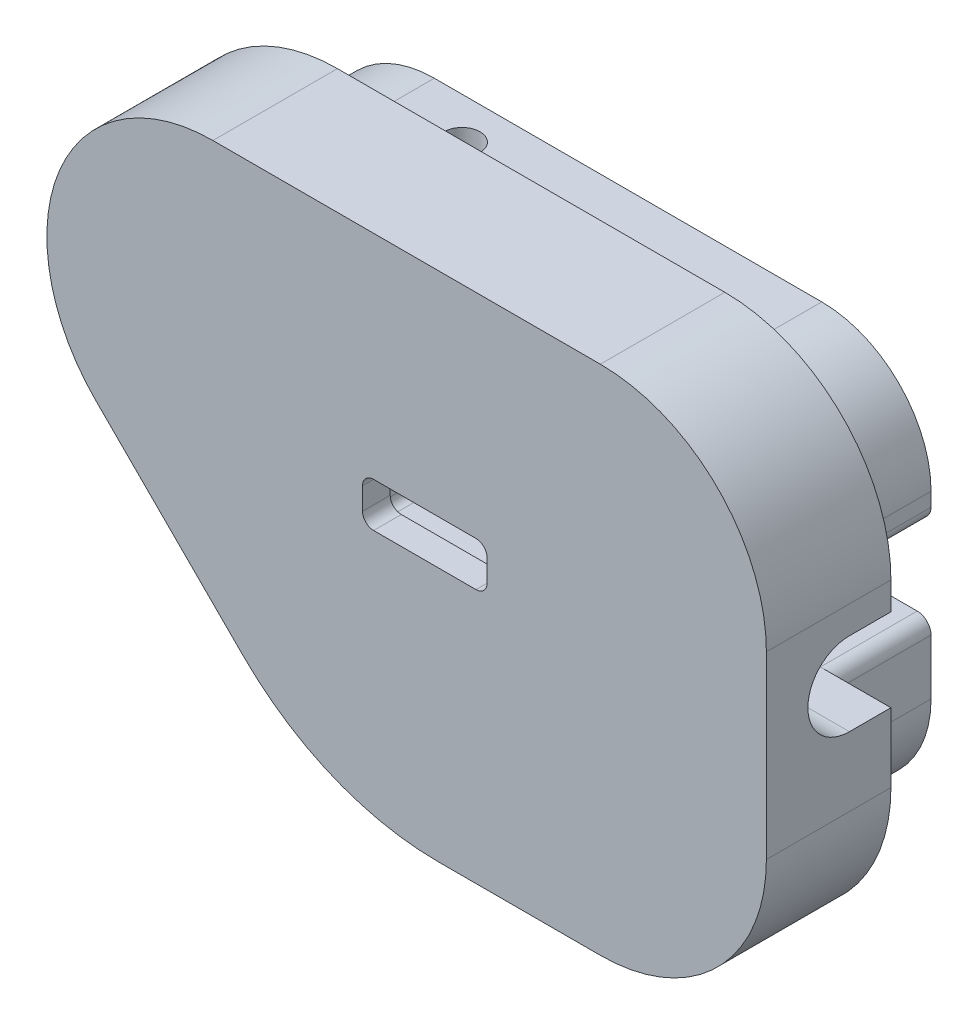
from build123d import *

# Parameters (mm, degrees)
EXTRUDE_1_DEPTH     = 9
EXTRUDE_2_DEPTH     = 7
SKETCH_6_R          = 1.3
CUT_EXTRUDE_1_DEPTH = 6
SKETCH_7_R          = 1.3
CUT_EXTRUDE_2_DEPTH = 6
CUT_EXTRUDE_3_DEPTH = 14
CUT_EXTRUDE_4_DEPTH = 2
EXTRUDE_START       = 9.4
EXTRUDE_4_DEPTH     = 9.4
SKETCH_11_R         = 1.3
CUT_EXTRUDE_5_DEPTH = 6
CHAMFER_1_SIZE      = 0.4
CHAMFER_1_SIZE2     = 1.098990968
CUT_EXTRUDE_6_DEPTH = 13
FILLET_1_R          = 3
FILLET_2_R          = 1


with BuildPart() as part:
    # 草图2 → 凸台-拉伸1 (new body)
    with BuildSketch(Plane.XY):
        with BuildLine():
            Line((-24.798989873, -3.485281374), (-14.142135624, -14.142135624))
            ThreePointArc((-14.142135624, -14.142135624), (-7.653668647, -18.47759065), (0, -20))
            Line((0, -20), (11.686291501, -20))
            ThreePointArc((11.686291501, -20), (20.171572875, -16.485281374), (23.686291501, -8))
            Line((23.686291501, -8), (23.686291501, 5))
            ThreePointArc((23.686291501, 5), (20.171572875, 13.485281374), (11.686291501, 17))
            Line((11.686291501, 17), (-16.313708499, 17))
            ThreePointArc((-16.313708499, 17), (-27.400262889, 9.592201188), (-24.798989873, -3.485281374))
        make_face()
    extrude(amount=-EXTRUDE_1_DEPTH)

    # 草图3 → 凸台-拉伸2 (add)
    with BuildSketch(Plane(origin=(0, 0, -9), x_dir=(-1, 0, 0), z_dir=(0, 0, -1))):
        with BuildLine():
            Line((16.313708499, 12.9), (-11.686291501, 12.9))
            ThreePointArc((-11.686291501, 12.9), (-17.272435072, 10.586143571), (-19.586291501, 5))
            Line((-19.586291501, 5), (-19.586291501, -8))
            ThreePointArc((-19.586291501, -8), (-17.272435072, -13.586143571), (-11.686291501, -15.9))
            Line((-11.686291501, -15.9), (0, -15.9))
            ThreePointArc((0, -15.9), (6.084666575, -14.689684567), (11.242997821, -11.242997821))
            Line((11.242997821, -11.242997821), (21.89985207, -0.586143571))
            ThreePointArc((21.89985207, -0.586143571), (23.612356806, 8.023199116), (16.313708499, 12.9))
        make_face()
    extrude(amount=EXTRUDE_2_DEPTH)

    # 草图6 → 切除-拉伸1 (cut)
    with BuildSketch(Plane(origin=(0, 12.9, 0), x_dir=(1, 0, 0), z_dir=(0, 1, 0))):
        with Locations(Location((-11.313708499, 13, 0), (0, 0, 180))):
            Circle(SKETCH_6_R)
    extrude(amount=-CUT_EXTRUDE_1_DEPTH, mode=Mode.SUBTRACT)

    # 草图7 → 切除-拉伸2 (cut)
    with BuildSketch(Plane.XZ.offset(15.9)):
        with Locations(Location((6.686291501, -13, 0), (0, 0, 270))):
            Circle(SKETCH_7_R)
    extrude(amount=-CUT_EXTRUDE_2_DEPTH, mode=Mode.SUBTRACT)

    # 草图8 → 切除-拉伸3 (cut)
    with BuildSketch(Plane(origin=(0, 0, -16), x_dir=(-1, 0, 0), z_dir=(0, 0, -1))):
        with BuildLine():
            Line((-4, 4), (14, 4))
            ThreePointArc((14, 4), (14.707106781, 3.707106781), (15, 3))
            Line((15, 3), (15, -3))
            ThreePointArc((15, -3), (14.707106781, -3.707106781), (14, -4))
            Line((14, -4), (-4, -4))
            ThreePointArc((-4, -4), (-4.707106781, -3.707106781), (-5, -3))
            Line((-5, -3), (-5, 3))
            ThreePointArc((-5, 3), (-4.707106781, 3.707106781), (-4, 4))
        make_face()
    extrude(amount=-CUT_EXTRUDE_3_DEPTH, mode=Mode.SUBTRACT)

    # 草图9 → 切除-拉伸4 (cut)
    with BuildSketch(Plane(origin=(0, 0, -2), x_dir=(-1, 0, 0), z_dir=(0, 0, -1))):
        with BuildLine():
            Line((-2.7, 1.6), (4.7, 1.6))
            ThreePointArc((4.7, 1.6), (5.265685425, 1.365685425), (5.5, 0.8))
            Line((5.5, 0.8), (5.5, -0.8))
            ThreePointArc((5.5, -0.8), (5.265685425, -1.365685425), (4.7, -1.6))
            Line((4.7, -1.6), (-2.7, -1.6))
            ThreePointArc((-2.7, -1.6), (-3.265685425, -1.365685425), (-3.5, -0.8))
            Line((-3.5, -0.8), (-3.5, 0.8))
            ThreePointArc((-3.5, 0.8), (-3.265685425, 1.365685425), (-2.7, 1.6))
        make_face()
    extrude(amount=-CUT_EXTRUDE_4_DEPTH, mode=Mode.SUBTRACT)

    # 草图10 → 凸台-拉伸4 (add)
    with BuildSketch(Plane(origin=(0, 0, -2), x_dir=(-1, 0, 0), z_dir=(0, 0, -1)).offset(EXTRUDE_START)):
        with BuildLine():
            Line((14, 4), (-4, 4))
            ThreePointArc((-4, 4), (-4.707106781, 3.707106781), (-5, 3))
            Line((-5, 3), (-5, -3))
            ThreePointArc((-5, -3), (-4.707106781, -3.707106781), (-4, -4))
            Line((-4, -4), (14, -4))
            ThreePointArc((14, -4), (14.707106781, -3.707106781), (15, -3))
            Line((15, -3), (15, 3))
            ThreePointArc((15, 3), (14.707106781, 3.707106781), (14, 4))
        make_face()
        with BuildLine():
            Line((-4, -2.6), (6, -2.6))
            ThreePointArc((6, -2.6), (6.424264069, -2.424264069), (6.6, -2))
            Line((6.6, -2), (6.6, 2))
            ThreePointArc((6.6, 2), (6.424264069, 2.424264069), (6, 2.6))
            Line((6, 2.6), (-4, 2.6))
            ThreePointArc((-4, 2.6), (-4.424264069, 2.424264069), (-4.6, 2))
            Line((-4.6, 2), (-4.6, -2))
            ThreePointArc((-4.6, -2), (-4.424264069, -2.424264069), (-4, -2.6))
        make_face(mode=Mode.SUBTRACT)
    extrude(amount=-EXTRUDE_4_DEPTH)

    # 草图11 → 切除-拉伸5 (cut)
    with BuildSketch(Plane(origin=(0, 0, -11.4), x_dir=(-1, 0, 0), z_dir=(0, 0, -1))):
        with Locations((10, 0)):
            Circle(SKETCH_11_R)
    extrude(amount=-CUT_EXTRUDE_5_DEPTH, mode=Mode.SUBTRACT)

    # 倒角1
    chamfer_1_edges = [part.edges().sort_by_distance(p)[0] for p in [
        (-8.7, 0, -11.4),
    ]]
    chamfer_1_side = [part.faces().sort_by_distance(p)[0] for p in [
        (-7.139463972, 0, -11.4),
    ]]
    chamfer(chamfer_1_edges, length=CHAMFER_1_SIZE, length2=CHAMFER_1_SIZE2, reference=chamfer_1_side[0])

    # 草图14 → 切除-拉伸6 (cut)
    with BuildSketch(Plane(origin=(0, 0, -16), x_dir=(-1, 0, 0), z_dir=(0, 0, -1))):
        with BuildLine():
            Line((-10.5, 3), (-23.686291501, 3))
            Line((-23.686291501, 3), (-23.686291501, -3))
            Line((-23.686291501, -3), (-10.5, -3))
            ThreePointArc((-10.5, -3), (-7.5, 0), (-10.5, 3))
        make_face()
    extrude(amount=-CUT_EXTRUDE_6_DEPTH, mode=Mode.SUBTRACT)

    # 圆角1
    fillet_1_edges = [part.edges().sort_by_distance(p)[0] for p in [
        (17.093145751, -3, -3),
        (17.093145751, 3, -3),
        (7.5, 0, -3),
    ]]
    fillet(fillet_1_edges, radius=FILLET_1_R - 0.0001)  # a hair under: the kernel refuses the full size

    # 圆角2
    fillet_2_edges = [part.edges().sort_by_distance(p)[0] for p in [
        (19.586291501, 3, -12.5),
        (19.586291501, -3, -12.5),
    ]]
    fillet(fillet_2_edges, radius=FILLET_2_R)


solid = part.part
